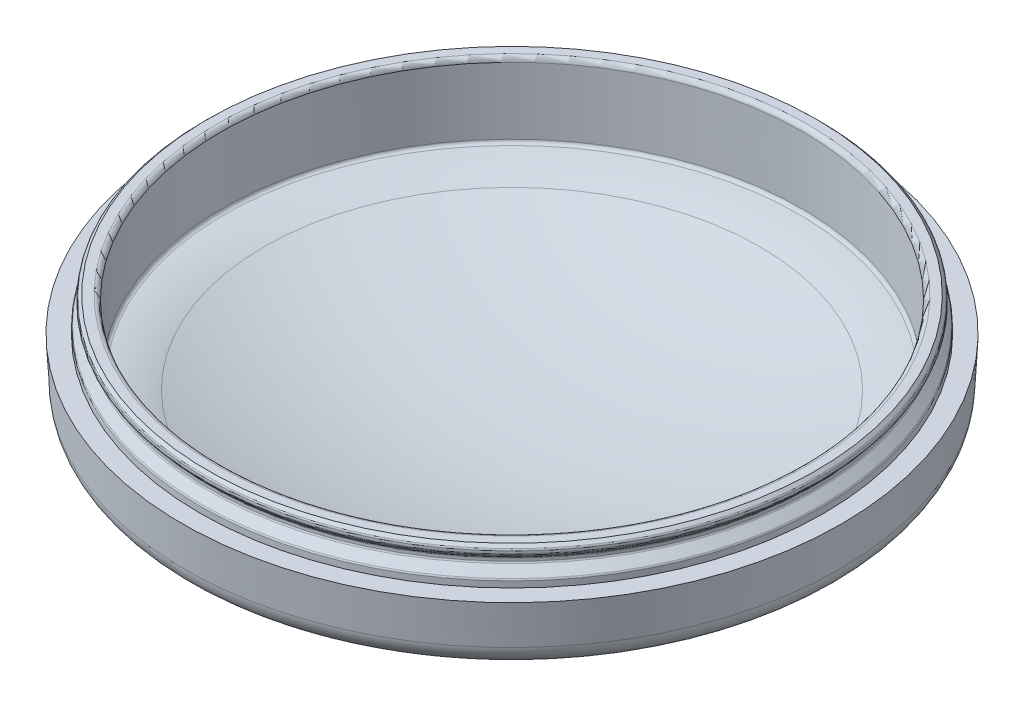
from build123d import *

# Parameters (mm, degrees)
SHELL1_T  = -1
FILLET2_R = 0.15
FILLET3_R = 0.2
FILLET4_R = 0.1


with BuildPart() as part:
    # Sketch3 → Revolve1 (revolve)
    with BuildSketch(Plane.XY, mode=Mode.PRIVATE) as revolve1_sk:
        with BuildLine():
            Line((0, 0), (-14.71721203, 0))
            Line((-14.71721203, 0), (-14.622669519, -1.803978578))
            ThreePointArc((-14.622669519, -1.803978578), (-14.304496998, -2.48443062), (-13.602377467, -2.751407959))
            ThreePointArc((-13.602377467, -2.751407959), (-12.49173295, -2.830685215), (-11.414862037, -3.113819746))
            ThreePointArc((-11.414862037, -3.113819746), (-5.795969269, -4.623740658), (0, -5.132225985))
            Line((0, -5.132225985), (0, 0))
        make_face()
    revolve(revolve1_sk.sketch.rotate(Axis((0, -5.132225985, 0), (0, 1, 0)), 180), axis=Axis((0, -5.132225985, 0), (0, 1, 0)))

    # Shell1
    shell1_openings = [part.faces().sort_by_distance(p)[0] for p in [
        (0, 0, 0),
    ]]
    offset(amount=SHELL1_T, openings=shell1_openings, kind=Kind.INTERSECTION)

    # Fillet1: read off the stored shape, not the designer's step
    # Fillet1 outline → Fillet1 (revolve)
    with BuildSketch(Plane.XY):
        with BuildLine():
            Line((13.648593596, -1.756499566), (13.648593596, -1.283131799))
            ThreePointArc((13.648593596, -1.283131799), (13.501190879, -1.612150966), (13.170820397, -1.756499566))
            Line((13.170820397, -1.756499566), (13.648593596, -1.756499566))
        make_face()
    revolve(axis=Axis((0, 0, 0), (0, 1, 0)))

    # Sketch4 → Revolve2 (revolve)
    with BuildSketch(Plane.XY, mode=Mode.PRIVATE) as revolve2_sk:
        Polygon((-13, 1.5), (-12.938907273, -2), (-13.95, -2), (-13.909682207, 0.309804838), (-13.502762166, 0.702762954), (-13.499271685, 0.902732493), (-13.8922298, 1.309652533), (-13.890484559, 1.409637303), (-13.800121862, 1.5), align=None)
    revolve(revolve2_sk.sketch.rotate(Axis((0, 0, 0), (0, 1, 0)), 270), axis=Axis((0, 0, 0), (0, 1, 0)))

    # Fillet2
    fillet2_edges = [part.edges().sort_by_distance(p)[0] for p in [
        (-9.152027206, -1.770053761, 9.152027206),
        (9.152027207, -1.770053761, -9.152027207),
    ]]
    fillet(fillet2_edges, radius=FILLET2_R)

    # Fillet3
    fillet3_edges = [part.edges().sort_by_distance(p)[0] for p in [
        (0, 1.5, 13),
    ]]
    fillet(fillet3_edges, radius=FILLET3_R)

    # Move Face1: read off the stored shape, not the designer's step
    # Move Face1 outline → Move Face1 (revolve, cut)
    with BuildSketch(Plane.XY):
        Polygon((13.587989828, 1.5), (13.74156509, 1.346424738), (13.744870507, 1.157057518), (13.8922298, 1.157057518), (13.8922298, 1.309652533), (13.890484559, 1.409637303), (13.800121862, 1.5), align=None)
    revolve(axis=Axis((0, 0, 0), (0, 1, 0)), mode=Mode.SUBTRACT)

    # Fillet4
    fillet4_edges = [part.edges().sort_by_distance(p)[0] for p in [
        (0, 0.309804838, 13.909682207),
        (-13.74156509, 1.346424738, 0),
        (9.719091142, 1.157057518, -9.719091142),
        (0, 0.902732493, 13.499271685),
        (0, 0.702762954, 13.502762166),
    ]]
    fillet(fillet4_edges, radius=FILLET4_R)


solid = part.part
